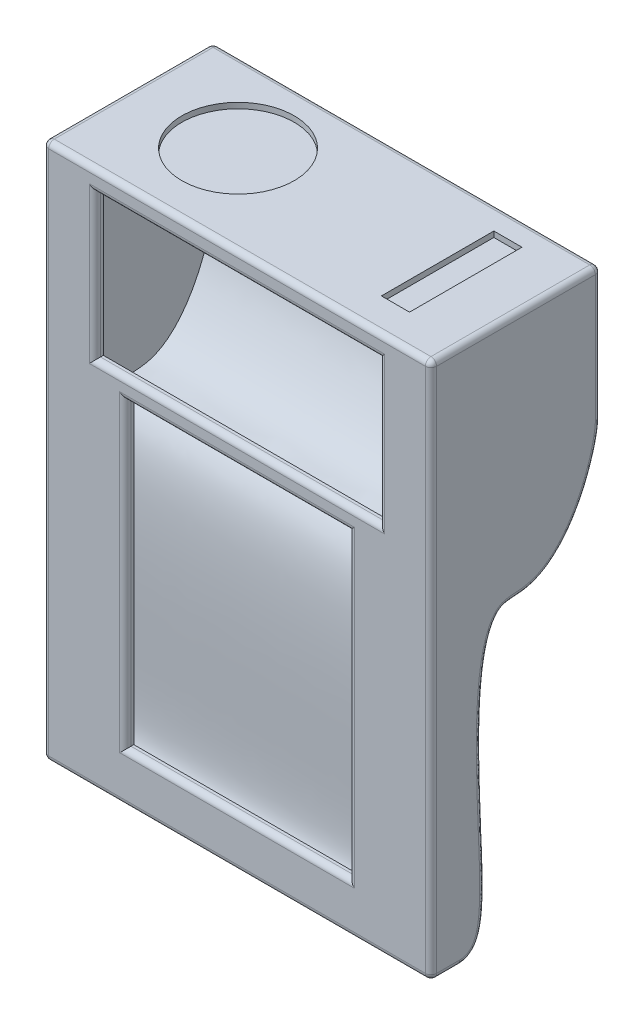
from build123d import *
from OCP.BRepAlgoAPI import BRepAlgoAPI_Cut
from OCP.TopTools import TopTools_ListOfShape

# Parameters (mm, degrees)
SKETCH1_W           = 66
SKETCH1_H           = 92.5
SKETCH1_W_2         = 39.72
SKETCH1_H_2         = 53.61
SKETCH1_W_3         = 50.55
SKETCH1_H_3         = 25.705
BOSS_EXTRUDE1_DEPTH = 1.5
SKETCH1_3_W         = 42.72
SKETCH1_3_H         = 56.61
SKETCH1_3_W_2       = 39.72
SKETCH1_3_H_2       = 53.61
BOSS_EXTRUDE2_DEPTH = 0.000481454
SKETCH1_4_W         = 53.55
SKETCH1_4_H         = 28.705
SKETCH1_4_W_2       = 50.55
SKETCH1_4_H_2       = 25.705
BOSS_EXTRUDE3_DEPTH = 0.000481454
BOSS_EXTRUDE4_START = -27.234481
SKETCH1_5_W         = 69
SKETCH1_5_H         = 95.5
SKETCH1_5_W_2       = 66
SKETCH1_5_H_2       = 92.5
BOSS_EXTRUDE4_DEPTH = 28.734481
BOSS_EXTRUDE5_START = -27.234481
SKETCH1_6_W         = 69
SKETCH1_6_H         = 95.5
BOSS_EXTRUDE5_DEPTH = 1.5
SKETCH2_R           = 10
SKETCH2_W           = 5
SKETCH2_H           = 20
CUT_EXTRUDE1_DEPTH  = 1
BOSS_EXTRUDE6_DEPTH = 69
CUT_EXTRUDE2_DEPTH  = 69
FILLET1_R           = 1


with BuildPart() as part:
    # Sketch1 → Boss-Extrude1 (new body)
    with BuildSketch(Plane.XY):
        with Locations((16.854577092, 61.467543122)):
            Rectangle(SKETCH1_W, SKETCH1_H)
        with Locations((16.854577092, 49.317142331)):
            Rectangle(SKETCH1_W_2, SKETCH1_H_2, mode=Mode.SUBTRACT)
        with Locations((16.854577092, 92.618043122)):
            Rectangle(SKETCH1_W_3, SKETCH1_H_3, mode=Mode.SUBTRACT)
    extrude(amount=BOSS_EXTRUDE1_DEPTH)

    # Sketch1<3> → Boss-Extrude2 (add)
    with BuildSketch(Plane.XY):
        with Locations((16.854577092, 49.317142331)):
            Rectangle(SKETCH1_3_W, SKETCH1_3_H)
        with Locations((16.854577092, 49.317142331)):
            Rectangle(SKETCH1_3_W_2, SKETCH1_3_H_2, mode=Mode.SUBTRACT)
    extrude(amount=-BOSS_EXTRUDE2_DEPTH)

    # Sketch1<4> → Boss-Extrude3 (add)
    with BuildSketch(Plane.XY):
        with Locations((16.854577092, 92.618043122)):
            Rectangle(SKETCH1_4_W, SKETCH1_4_H)
        with Locations((16.854577092, 92.618043122)):
            Rectangle(SKETCH1_4_W_2, SKETCH1_4_H_2, mode=Mode.SUBTRACT)
    extrude(amount=-BOSS_EXTRUDE3_DEPTH)

    # Sketch1<5> → Boss-Extrude4 (add)
    with BuildSketch(Plane.XY.offset(BOSS_EXTRUDE4_START)):
        with Locations((16.854577092, 61.467543122)):
            Rectangle(SKETCH1_5_W, SKETCH1_5_H)
        with Locations((16.854577092, 61.467543122)):
            Rectangle(SKETCH1_5_W_2, SKETCH1_5_H_2, mode=Mode.SUBTRACT)
    extrude(amount=BOSS_EXTRUDE4_DEPTH)

    # Sketch1<6> → Boss-Extrude5 (add)
    with BuildSketch(Plane.XY.offset(BOSS_EXTRUDE5_START)):
        with Locations((16.854577092, 61.467543122)):
            Rectangle(SKETCH1_6_W, SKETCH1_6_H)
    extrude(amount=-BOSS_EXTRUDE5_DEPTH)

    # Sketch2 → Cut-Extrude1 (cut)
    with BuildSketch(Plane(origin=(0, 109.217543122, 0), x_dir=(1, 0, 0), z_dir=(0, 1, 0))):
        with Locations(Location((1.104577092, 14.434481454, 0), (0, 0, 270))):
            Circle(SKETCH2_R)
        with Locations((39.104577092, 14.434481454)):
            Rectangle(SKETCH2_W, SKETCH2_H)
    extrude(amount=-CUT_EXTRUDE1_DEPTH, mode=Mode.SUBTRACT)


with BuildPart() as boss_extrude6_tool:
    # Sketch3 → Boss-Extrude6 (new body)
    with BuildSketch(Plane.ZY.offset(17.645422908)):
        with BuildLine():
            Line((-27.234481454, 85.717543122), (-28.734481454, 85.717543122))
            add(Edge.make_bspline(
                [(-28.734481454, 85.717543122), (-28.734481454, 85.482961848), (-28.713426819, 85.032014995), (-28.599368699, 83.989530035), (-28.327378371, 82.503220116), (-27.796606418, 80.452069574), (-26.813417093, 77.480599085), (-25.412537724, 74.327492767), (-23.566003439, 71.35987394), (-21.941924274, 69.320458144), (-20.0574415, 67.566996216), (-18.23803343, 66.441994501), (-16.641971762, 65.820124965), (-14.912257127, 65.410261892), (-13.287215332, 65.367870537), (-12.055982075, 65.206650567), (-11.400199504, 65.001082068), (-10.886813529, 64.664914533), (-10.133976336, 63.861779124), (-9.249582602, 62.160219071), (-8.177957117, 58.203137328), (-7.541979932, 51.626267361), (-7.544452498, 44.301069476), (-7.690057087, 38.79487834), (-7.87460298, 33.676929904), (-8.120364827, 27.993916783), (-8.209184119, 23.352132412), (-8.073131549, 20.280610018), (-7.832147666, 18.288476154), (-7.396333685, 16.583759405), (-6.658501888, 15.113298201), (-5.34246819, 13.959818786), (-4.171043714, 13.717543122), (-3.601382389, 13.717543122)],
                knots=[0, 0, 0, 0, 0.015625, 0.03125, 0.0625, 0.09375, 0.125, 0.1875, 0.21875, 0.25, 0.28125, 0.3125, 0.328125, 0.34375, 0.375, 0.390625, 0.40625, 0.421875, 0.4375, 0.46875, 0.5, 0.5625, 0.625, 0.65625, 0.6875, 0.75, 0.8125, 0.84375, 0.875, 0.90625, 0.9375, 0.96875, 1, 1, 1, 1], degree=3))
            Line((-3.601382389, 13.717543122), (-3.601382389, 15.217543122))
            add(Edge.make_bspline(
                [(-27.234481454, 85.717543122), (-27.234481454, 81.857820304), (-22.389427868, 65.884190774), (-6.089185063, 67.542492211), (-5.62560349, 31.34951489), (-7.937333165, 15.217543122), (-3.601382389, 15.217543122)],
                knots=[0, 0, 0, 0, 0.343298556, 0.407294911, 0.639963552, 1, 1, 1, 1], degree=3))
        make_face()
    extrude(amount=-BOSS_EXTRUDE6_DEPTH)


with BuildPart() as part_1:
    add(part.part)


with BuildPart() as part_2:
    # Boss-Extrude6: joined with boss_extrude6_tool
    add(part_1.part.fuse(boss_extrude6_tool.part, tol=0.00001))


with BuildPart() as cut_extrude2_tool:
    # Sketch3<3> → Cut-Extrude2 (new body)
    with BuildSketch(Plane.ZY.offset(17.645422908)):
        with BuildLine():
            add(Edge.make_bspline(
                [(-28.734481454, 85.717543122), (-28.734481454, 85.482961848), (-28.713426819, 85.032014995), (-28.599368699, 83.989530035), (-28.327378371, 82.503220116), (-27.796606418, 80.452069574), (-26.813417093, 77.480599085), (-25.412537724, 74.327492767), (-23.566003439, 71.35987394), (-21.941924274, 69.320458144), (-20.0574415, 67.566996216), (-18.23803343, 66.441994501), (-16.641971762, 65.820124965), (-14.912257127, 65.410261892), (-13.287215332, 65.367870537), (-12.055982075, 65.206650567), (-11.400199504, 65.001082068), (-10.886813529, 64.664914533), (-10.133976336, 63.861779124), (-9.249582602, 62.160219071), (-8.177957117, 58.203137328), (-7.541979932, 51.626267361), (-7.544452498, 44.301069476), (-7.690057087, 38.79487834), (-7.87460298, 33.676929904), (-8.120364827, 27.993916783), (-8.209184119, 23.352132412), (-8.073131549, 20.280610018), (-7.832147666, 18.288476154), (-7.396333685, 16.583759405), (-6.658501888, 15.113298201), (-5.34246819, 13.959818786), (-4.171043714, 13.717543122), (-3.601382389, 13.717543122)],
                knots=[0, 0, 0, 0, 0.015625, 0.03125, 0.0625, 0.09375, 0.125, 0.1875, 0.21875, 0.25, 0.28125, 0.3125, 0.328125, 0.34375, 0.375, 0.390625, 0.40625, 0.421875, 0.4375, 0.46875, 0.5, 0.5625, 0.625, 0.65625, 0.6875, 0.75, 0.8125, 0.84375, 0.875, 0.90625, 0.9375, 0.96875, 1, 1, 1, 1], degree=3))
            Line((-28.734481454, 85.717543122), (-28.734481454, 13.717543122))
            Line((-28.734481454, 13.717543122), (-3.601382389, 13.717543122))
        make_face()
    extrude(amount=-CUT_EXTRUDE2_DEPTH)


with BuildPart() as part_3:
    add(part_2.part)

    # Cut-Extrude2: cut by cut_extrude2_tool, with a tolerance
    cut_extrude2_stock = TopTools_ListOfShape()
    cut_extrude2_stock.Append(part_3.part.wrapped)
    cut_extrude2_tools = TopTools_ListOfShape()
    cut_extrude2_tools.Append(cut_extrude2_tool.part.wrapped)
    cut_extrude2_cut = BRepAlgoAPI_Cut()
    cut_extrude2_cut.SetArguments(cut_extrude2_stock)
    cut_extrude2_cut.SetTools(cut_extrude2_tools)
    cut_extrude2_cut.SetFuzzyValue(0.00001)
    cut_extrude2_cut.Build()
    add(Compound.cast(cut_extrude2_cut.Shape()).solids(), mode=Mode.REPLACE)

    # Fillet1
    fillet1_edges = [part_3.edges().sort_by_distance(p)[0] for p in [
        (-17.645422908, 97.467543122, -28.734481),
        (16.854577092, 109.217543122, -28.734481),
        (51.354577092, 97.467543122, -28.734481),
        (-17.645422908, 53.538602522, -7.790240018),
        (51.354577092, 53.538602522, -7.790240018),
        (-8.420422908, 92.618043122, 1.5),
        (16.854577092, 105.470543122, 1.5),
        (42.129577092, 92.618043122, 1.5),
        (16.854577092, 79.765543122, 1.5),
        (-3.005422908, 49.317142331, 1.5),
        (16.854577092, 76.122142331, 1.5),
        (36.714577092, 49.317142331, 1.5),
        (16.854577092, 22.512142331, 1.5),
        (51.354577092, 61.467543122, 1.5),
        (51.354577092, 13.717543122, -1.050691195),
        (16.854577092, 109.217543122, 1.5),
        (51.354577092, 109.217543122, -13.6172405),
        (-17.645422908, 109.217543122, -13.6172405),
        (-17.645422908, 13.717543122, -1.050691195),
        (-17.645422908, 61.467543122, 1.5),
        (16.854577092, 13.717543122, 1.5),
    ]]
    fillet(fillet1_edges, radius=FILLET1_R)


solid = part_3.part
